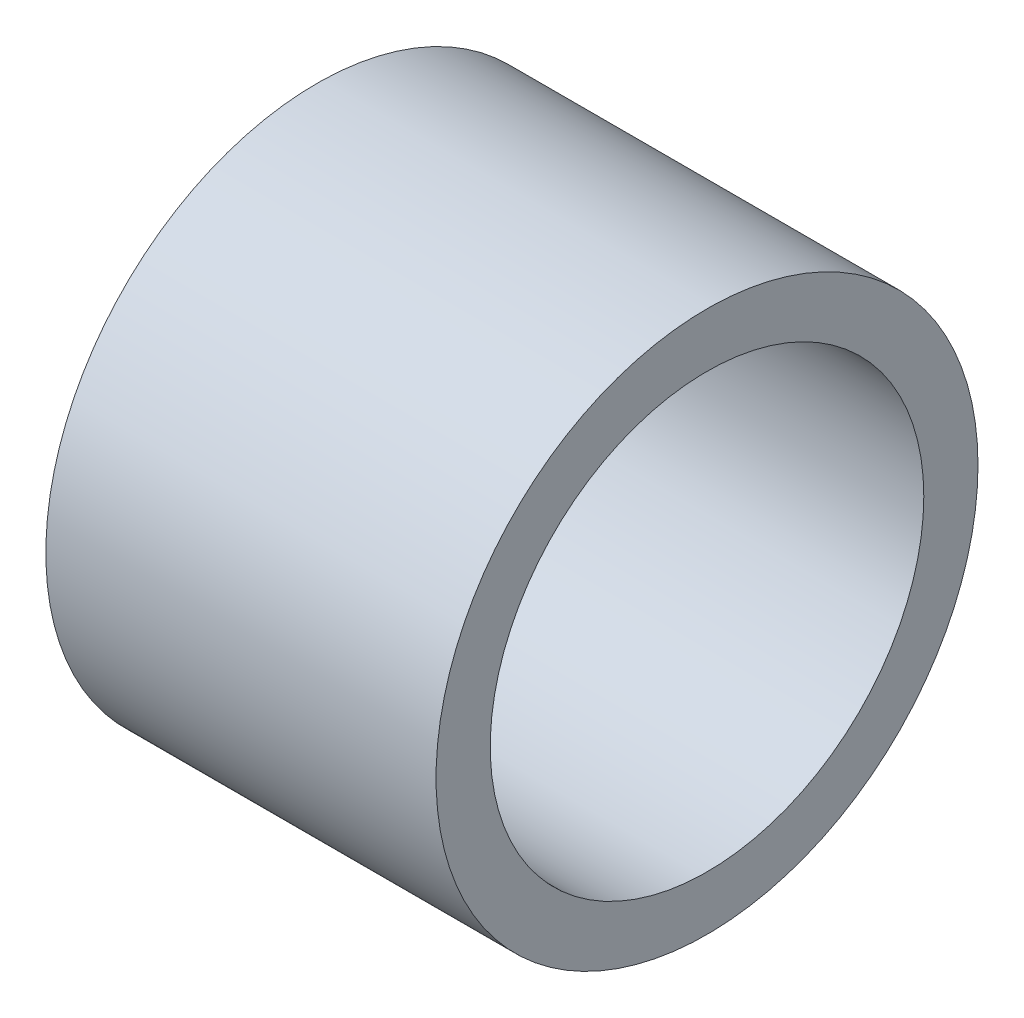
from build123d import *

# Parameters (mm, degrees)
SKETCH2_R           = 7.9375
SKETCH2_R_2         = 6.35
BOSS_EXTRUDE1_DEPTH = 11.43


with BuildPart() as part:
    # Sketch2 → Boss-Extrude1 (new body)
    with BuildSketch(Plane.YZ):
        Circle(SKETCH2_R)
        Circle(SKETCH2_R_2, mode=Mode.SUBTRACT)
    extrude(amount=BOSS_EXTRUDE1_DEPTH)


solid = part.part
